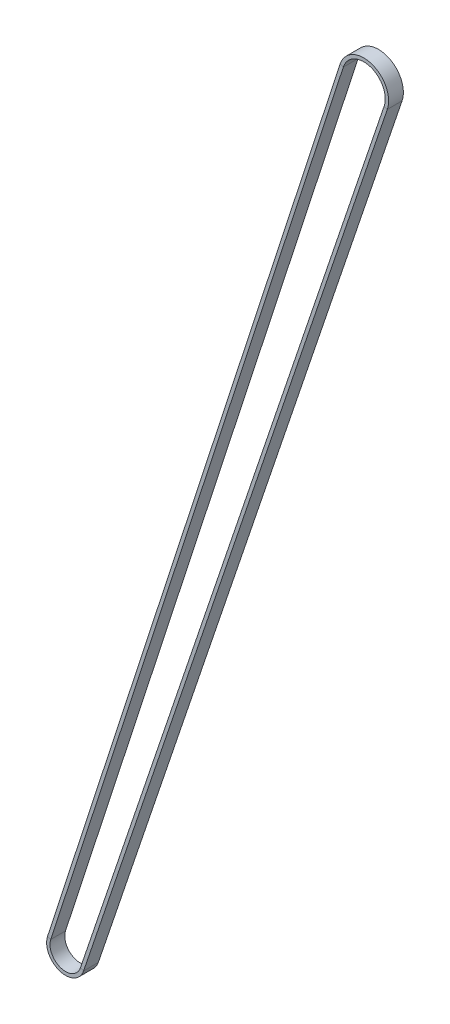
from build123d import *

# Parameters (mm, degrees)
SKETCH2_W = 1.38
SKETCH2_H = 6


with BuildPart() as part:
    # Sweep1: sweep along a path in Sketch1
    with BuildLine(Plane.XY) as sweep1_path:
        Line((6.01523436, -2.034565211), (129.672217689, 363.559877783))
        ThreePointArc((129.672217689, 363.559877783), (124.135446545, 374.669394664), (113.060574593, 369.063646606))
        Line((113.060574593, 369.063646606), (-6.040072344, 1.95959845))
        ThreePointArc((-6.040072344, 1.95959845), (-1.997120444, -6.027769897), (6.01523436, -2.034565211))
    # Sketch2 → Sweep1 (sweep)
    with BuildSketch(Plane(origin=(113.060574593, 369.063646606, 0), x_dir=(0.9511924950523241, -0.3085981810642029, 0), z_dir=(0.3085981810642029, 0.9511924950523241, 0))):
        with Locations((-0.69, 0)):
            Rectangle(SKETCH2_W, SKETCH2_H)
    sweep(path=sweep1_path.line)


solid = part.part
